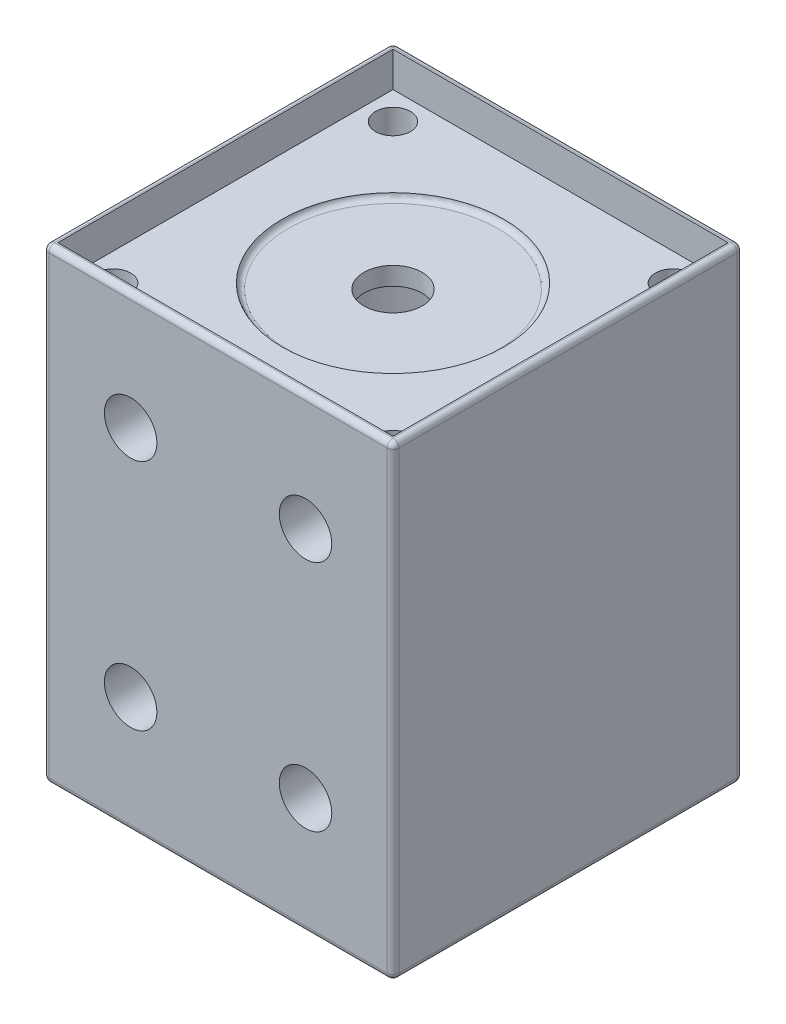
from build123d import *

# Parameters (mm, degrees)
SZKIC1_W                     = 60
SZKIC1_H                     = 60
DODANIE_WYCI_GNI_CIE1_DEPTH  = 80
SZKIC2_W                     = 57.5
SZKIC2_H                     = 57.5
WYTNIJ_WYCI_GNI_CIE1_DEPTH   = 6
SZKIC3_R                     = 5
WYTNIJ_WYCI_GNI_CIE2_DEPTH   = 24
SZKIC4_R                     = 19
WYTNIJ_WYCI_GNI_CIE3_DEPTH   = 0.9
ZAOKR_GLENIE1_R              = 1
OTWORY_USTALAJ_CE_6_0MM1_D   = 6
SZKIC8_R                     = 21
WYTNIJ_WYCI_GNI_CIE5_DEPTH   = 70
ZAOKR_GLENIE2_R              = 1
OTW_R_POD_RUB_M81_AT_2_COUNT = 2
OTW_R_POD_RUB_M81_AT_2_PITCH = 30
OTW_R_POD_RUB_M81_AT_3_COUNT = 2
OTW_R_POD_RUB_M81_AT_3_PITCH = 50
OTW_R_POD_RUB_M81_AT_4_COUNT = 2
OTW_R_POD_RUB_M81_AT_4_PITCH = 40


with BuildPart() as part:
    # Szkic1 → Dodanie-wyciągnięcie1 (new body)
    with BuildSketch(Plane(origin=(0, 0, 0), x_dir=(1, 0, 0), z_dir=(0, 1, 0))):
        Rectangle(SZKIC1_W, SZKIC1_H)
    extrude(amount=DODANIE_WYCI_GNI_CIE1_DEPTH)

    # Szkic2 → Wytnij-wyciągnięcie1 (cut)
    with BuildSketch(Plane(origin=(0, 80, 0), x_dir=(1, 0, 0), z_dir=(0, 1, 0))):
        Rectangle(SZKIC2_W, SZKIC2_H)
    extrude(amount=-WYTNIJ_WYCI_GNI_CIE1_DEPTH, mode=Mode.SUBTRACT)

    # Szkic3 → Wytnij-wyciągnięcie2 (cut)
    with BuildSketch(Plane(origin=(0, 74, 0), x_dir=(1, 0, 0), z_dir=(0, 1, 0))):
        with Locations(Location((0, 0, 0), (0, 0, 270))):
            Circle(SZKIC3_R)
    extrude(amount=-WYTNIJ_WYCI_GNI_CIE2_DEPTH, mode=Mode.SUBTRACT)

    # Szkic4 → Wytnij-wyciągnięcie3 (cut)
    with BuildSketch(Plane(origin=(0, 74, 0), x_dir=(1, 0, 0), z_dir=(0, 1, 0))):
        with Locations(Location((0, 0, 0), (0, 0, 270))):
            Circle(SZKIC4_R)
    extrude(amount=-WYTNIJ_WYCI_GNI_CIE3_DEPTH, mode=Mode.SUBTRACT)

    # Zaokrąglenie1
    # the kernel refuses this fillet: 1 mm, written as the material it adds along each edge
    with BuildSketch(Plane(origin=(0, 73.1, 0), x_dir=(0, 0, 1), z_dir=(-1, 0, 0))) as zaokr_glenie1_piece_1:
        with BuildLine():
            CenterArc((18.005012563, 1), ZAOKR_GLENIE1_R, 270, 84.260829523)
            Line((18.005012563, 0), (18.005012563, -0.02))
            Line((18.005012563, -0.02), (19, -0.02))
            Line((19, -0.02), (19.02, 0))
            ThreePointArc((19.02, 0), (19.02, 0.45), (19.019899749, 0.898))
            Line((19.019899749, 0.898), (19, 0.9))
        make_face()
    revolve(axis=Axis((0, 73.1, 0), (0, 1, 0)))

    # Otwory ustalające Ø6.0mm1 (through all)
    with Locations(Plane(origin=(0, 74, 0), x_dir=(1, 0, 0), z_dir=(0, 1, 0))):
        with Locations((-24, 24), (24, 24), (24, -24), (-24, -24)):
            Hole(OTWORY_USTALAJ_CE_6_0MM1_D / 2)

    # Szkic8 → Wytnij-wyciągnięcie5 (cut)
    with BuildSketch(Plane.XZ):
        with Locations(Location((0, 0, 0), (0, 0, 270))):
            Circle(SZKIC8_R)
    extrude(amount=-WYTNIJ_WYCI_GNI_CIE5_DEPTH, mode=Mode.SUBTRACT)

    # Zaokrąglenie2
    zaokr_glenie2_edges = [part.edges().sort_by_distance(p)[0] for p in [
        (30, 80, 0),
        (0, 80, -30),
        (-30, 80, 0),
        (0, 0, -30),
        (30, 0, 0),
        (0, 0, 30),
        (-30, 0, 0),
        (-30, 40, -30),
        (30, 40, -30),
        (30, 40, 30),
        (-30, 40, 30),
        (0, 80, 30),
    ]]
    fillet(zaokr_glenie2_edges, radius=ZAOKR_GLENIE2_R)

    # Szkic11 → Otwór pod śrubę M81 (revolve, cut)
    with BuildSketch(Plane(origin=(15, 60, -30), x_dir=(0, 1, 0), z_dir=(1, 0, 0))):
        Polygon((0, 0), (0, 12.703872786), (4.5, 10), (4.5, 0), align=None)
    otw_r_pod_rub_m81 = revolve(axis=Axis((15, 60, -36.35), (0, 0, 1)), mode=Mode.SUBTRACT)

    # Otwór pod śrubę M81 at 2: Otwór pod śrubę M81 ×2
    with Locations(*[(-i * OTW_R_POD_RUB_M81_AT_2_PITCH, 0, 0) for i in range(1, OTW_R_POD_RUB_M81_AT_2_COUNT)]):
        add(otw_r_pod_rub_m81, mode=Mode.SUBTRACT)

    # Otwór pod śrubę M81 at 3: Otwór pod śrubę M81 ×2
    with Locations(*[Vector(-0.6, -0.8000000000000002, 0) * (i * OTW_R_POD_RUB_M81_AT_3_PITCH) for i in range(1, OTW_R_POD_RUB_M81_AT_3_COUNT)]):
        add(otw_r_pod_rub_m81, mode=Mode.SUBTRACT)

    # Otwór pod śrubę M81 at 4: Otwór pod śrubę M81 ×2
    with Locations(*[(0, -i * OTW_R_POD_RUB_M81_AT_4_PITCH, 0) for i in range(1, OTW_R_POD_RUB_M81_AT_4_COUNT)]):
        add(otw_r_pod_rub_m81, mode=Mode.SUBTRACT)

    # Lustro1: Otwór pod śrubę M81 across plane
    add(otw_r_pod_rub_m81.mirror(Plane.XY), mode=Mode.SUBTRACT)

    # Lustro1 copy 1 sketch → Lustro1 copy 1 (revolve, cut)
    with BuildSketch(Plane(origin=(-15, 60, 30), x_dir=(0, 1, 0), z_dir=(1, 0, 0))):
        Polygon((0, 0), (0, -12.703872786), (4.5, -10), (4.5, 0), align=None)
    revolve(axis=Axis((-15, 60, 36.35), (0, 0, 1)), mode=Mode.SUBTRACT)

    # Lustro1 copy 2 sketch → Lustro1 copy 2 (revolve, cut)
    with BuildSketch(Plane(origin=(-15, 20, 30), x_dir=(0, 1, 0), z_dir=(1, 0, 0))):
        Polygon((0, 0), (0, -12.703872786), (4.5, -10), (4.5, 0), align=None)
    revolve(axis=Axis((-15, 20, 36.35), (0, 0, 1)), mode=Mode.SUBTRACT)

    # Lustro1 copy 3 sketch → Lustro1 copy 3 (revolve, cut)
    with BuildSketch(Plane(origin=(15, 20, 30), x_dir=(0, 1, 0), z_dir=(1, 0, 0))):
        Polygon((0, 0), (0, -12.703872786), (4.5, -10), (4.5, 0), align=None)
    revolve(axis=Axis((15, 20, 36.35), (0, 0, 1)), mode=Mode.SUBTRACT)


solid = part.part
